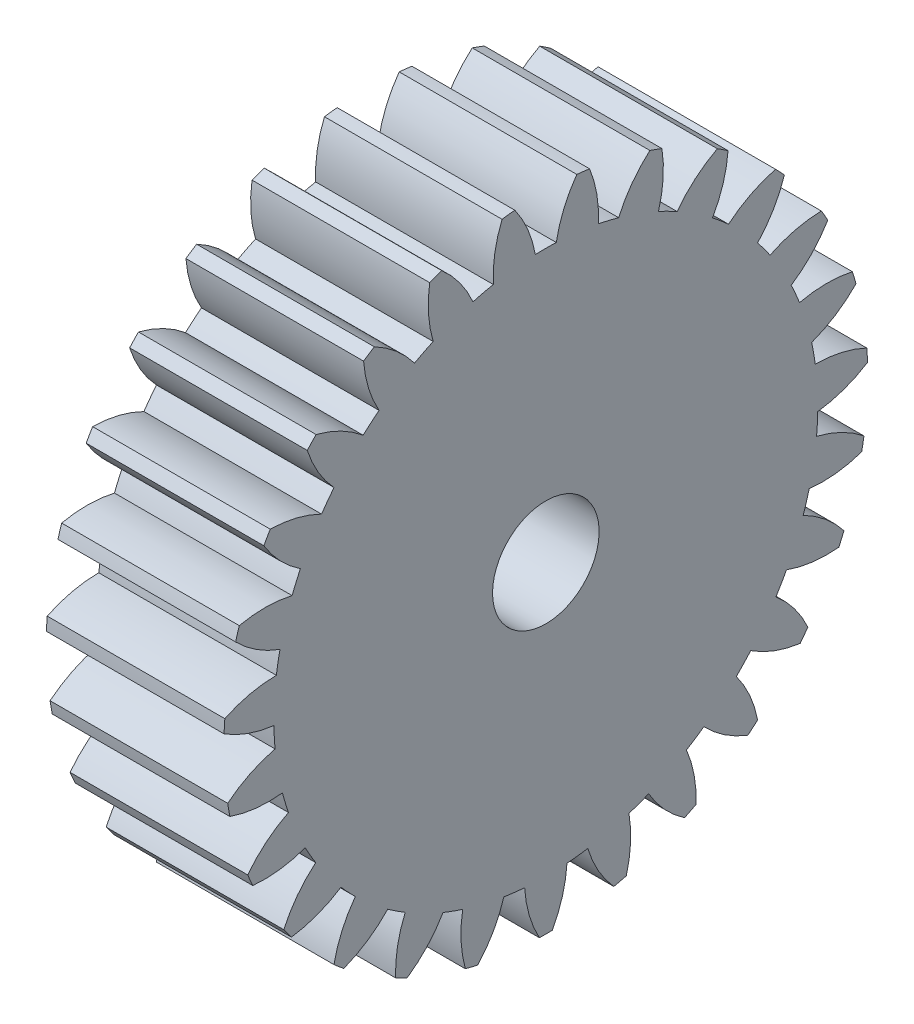
from build123d import *

# Parameters (mm, degrees)
SPUR_START               = -2.344914802
SPUR_GEAR_AM_OUTLINE_R   = 3
SPUR_GEAR_AM_DEPTH       = 10
RESSALTO_EXTRUS_O1_START = 4.5
ESBO_O9_R                = 8
ESBO_O9_R_2              = 3
RESSALTO_EXTRUS_O1_DEPTH = 4.5
FILETE1_R                = 1.5
CORTE_EXTRUS_O3_DEPTH    = 3
CHANFRO4_SIZE            = 0.7


# Read off the part's stored shape, not the designer's step: spur gear_am
with BuildPart() as part:
    # spur gear_am outline → spur gear_am (new body)
    with BuildSketch(Plane.YZ.offset(SPUR_START)):
        with BuildLine():
            ThreePointArc((23.883783824, 84.255149741), (23.52309445, 84.279769213), (23.161985782, 84.297189689))
            ThreePointArc((23.161985782, 84.297189689), (22.508279443, 82.951048342), (22.167237879, 81.493955635))
            ThreePointArc((22.167237879, 81.493955635), (21.578934878, 81.47102921), (20.991948176, 81.425502804))
            ThreePointArc((20.991948176, 81.425502804), (20.484054474, 82.833150662), (19.678490792, 84.09429921))
            ThreePointArc((19.678490792, 84.09429921), (19.321846205, 84.035074368), (18.96645383, 83.968747883))
            ThreePointArc((18.96645383, 83.968747883), (18.64080979, 82.508136893), (18.644989749, 81.011670711))
            ThreePointArc((18.644989749, 81.011670711), (18.077831728, 80.853690262), (17.51716644, 80.674022578))
            ThreePointArc((17.51716644, 80.674022578), (16.698337143, 81.926598758), (15.623646663, 82.967977113))
            ThreePointArc((15.623646663, 82.967977113), (15.290273666, 82.828100782), (14.959756879, 82.681603014))
            ThreePointArc((14.959756879, 82.681603014), (14.97973069, 81.185264298), (15.32890683, 79.730099521))
            ThreePointArc((15.32890683, 79.730099521), (14.813469426, 79.445581815), (14.309351163, 79.141458782))
            ThreePointArc((14.309351163, 79.141458782), (13.223729568, 80.171436577), (11.937849134, 80.936903764))
            ThreePointArc((11.937849134, 80.936903764), (11.645719951, 80.723916713), (11.357896997, 80.505145394))
            ThreePointArc((11.357896997, 80.505145394), (11.722411868, 79.053746961), (12.397760011, 77.718331898))
            ThreePointArc((12.397760011, 77.718331898), (11.961830588, 77.322615357), (11.541436495, 76.910432328))
            ThreePointArc((11.541436495, 76.910432328), (10.247548746, 77.66228537), (8.819800503, 78.110574853))
            ThreePointArc((8.819800503, 78.110574853), (8.584663894, 77.83595927), (8.355051383, 77.556708419))
            ThreePointArc((8.355051383, 77.556708419), (9.044456222, 76.228495532), (10.009568176, 75.084822755))
            ThreePointArc((10.009568176, 75.084822755), (9.676647801, 74.599240562), (9.362641435, 74.10121843))
            ThreePointArc((9.362641435, 74.10121843), (7.930241353, 74.534414126), (6.437595579, 74.641358504))
            ThreePointArc((6.437595579, 74.641358504), (6.27212782, 74.319918986), (6.113104222, 73.995243088))
            ThreePointArc((6.113104222, 73.995243088), (7.090233035, 72.861820049), (8.293079365, 71.971545254))
            ThreePointArc((8.293079365, 71.971545254), (8.081115863, 71.422275269), (7.890425386, 70.865262536))
            ThreePointArc((7.890425386, 70.865262536), (6.396734031, 70.956447194), (4.919659647, 70.716281067))
            ThreePointArc((4.919659647, 70.716281067), (4.832781147, 70.365346502), (4.752919465, 70.01274892))
            ThreePointArc((4.752919465, 70.01274892), (5.965094986, 69.135218857), (7.340829935, 68.546336988))
            ThreePointArc((7.340829935, 68.546336988), (7.261250311, 67.962990499), (7.204155897, 67.377015866))
            ThreePointArc((7.204155897, 67.377015866), (5.729698557, 67.121273697), (4.347825024, 66.546944484))
            ThreePointArc((4.347825024, 66.546944484), (4.344219426, 66.185433844), (4.347825024, 65.823923205))
            ThreePointArc((4.347825024, 65.823923205), (5.729698557, 65.249593992), (7.204155897, 64.993851823))
            ThreePointArc((7.204155897, 64.993851823), (7.261250311, 64.40787719), (7.340829935, 63.824530701))
            ThreePointArc((7.340829935, 63.824530701), (5.965094986, 63.235648832), (4.752919465, 62.358118769))
            ThreePointArc((4.752919465, 62.358118769), (4.832781147, 62.005521187), (4.919659647, 61.654586622))
            ThreePointArc((4.919659647, 61.654586622), (6.396734031, 61.414420495), (7.890425386, 61.505605153))
            ThreePointArc((7.890425386, 61.505605153), (8.081115863, 60.94859242), (8.293079365, 60.399322436))
            ThreePointArc((8.293079365, 60.399322436), (7.090233035, 59.50904764), (6.113104222, 58.375624601))
            ThreePointArc((6.113104222, 58.375624601), (6.27212782, 58.050948703), (6.437595579, 57.729509185))
            ThreePointArc((6.437595579, 57.729509185), (7.930241353, 57.836453563), (9.362641435, 58.269649259))
            ThreePointArc((9.362641435, 58.269649259), (9.676647801, 57.771627127), (10.009568176, 57.286044934))
            ThreePointArc((10.009568176, 57.286044934), (9.044456222, 56.142372157), (8.355051383, 54.81415927))
            ThreePointArc((8.355051383, 54.81415927), (8.584663894, 54.534908419), (8.819800503, 54.260292836))
            ThreePointArc((8.819800503, 54.260292836), (10.247548746, 54.708582319), (11.541436495, 55.460435361))
            ThreePointArc((11.541436495, 55.460435361), (11.961830588, 55.048252332), (12.397760011, 54.652535791))
            ThreePointArc((12.397760011, 54.652535791), (11.722411868, 53.317120728), (11.357896997, 51.865722295))
            ThreePointArc((11.357896997, 51.865722295), (11.645719951, 51.646950976), (11.937849134, 51.433963925))
            ThreePointArc((11.937849134, 51.433963925), (13.223729568, 52.199431112), (14.309351163, 53.229408907))
            ThreePointArc((14.309351163, 53.229408907), (14.813469426, 52.925285874), (15.32890683, 52.640768168))
            ThreePointArc((15.32890683, 52.640768168), (14.97973069, 51.185603391), (14.959756879, 49.689264676))
            ThreePointArc((14.959756879, 49.689264676), (15.290273666, 49.542766907), (15.623646663, 49.402890576))
            ThreePointArc((15.623646663, 49.402890576), (16.698337143, 50.444268931), (17.51716644, 51.696845111))
            ThreePointArc((17.51716644, 51.696845111), (18.077831728, 51.517177427), (18.644989749, 51.359196978))
            ThreePointArc((18.644989749, 51.359196978), (18.64080979, 49.862730796), (18.96645383, 48.402119806))
            ThreePointArc((18.96645383, 48.402119806), (19.321846205, 48.335793321), (19.678490792, 48.276568479))
            ThreePointArc((19.678490792, 48.276568479), (20.484054474, 49.537717027), (20.991948176, 50.945364885))
            ThreePointArc((20.991948176, 50.945364885), (21.578934878, 50.899838479), (22.167237879, 50.876912054))
            ThreePointArc((22.167237879, 50.876912054), (22.508279443, 49.419819347), (23.161985782, 48.073678))
            ThreePointArc((23.161985782, 48.073678), (23.52309445, 48.091098476), (23.883783824, 48.115717948))
            ThreePointArc((23.883783824, 48.115717948), (24.376792562, 49.528647844), (24.546369987, 51.01548072))
            ThreePointArc((24.546369987, 51.01548072), (25.128033498, 51.106549934), (25.705765913, 51.219913503))
            ThreePointArc((25.705765913, 51.219913503), (26.373643361, 49.880746516), (27.32017052, 48.721645639))
            ThreePointArc((27.32017052, 48.721645639), (27.667528019, 48.821873934), (28.012817323, 48.929010479))
            ThreePointArc((28.012817323, 48.929010479), (28.166692889, 50.417550306), (27.988812073, 51.903412655))
            ThreePointArc((27.988812073, 51.903412655), (28.533794764, 52.126167924), (29.069810889, 52.369710027))
            ThreePointArc((29.069810889, 52.369710027), (30.028518774, 51.220663599), (31.216839229, 50.311090621))
            ThreePointArc((31.216839229, 50.311090621), (31.531719426, 50.488723401), (31.842994024, 50.672601261))
            ThreePointArc((31.842994024, 50.672601261), (31.649440946, 52.156503451), (31.133691492, 53.561292049))
            ThreePointArc((31.133691492, 53.561292049), (31.612613202, 53.903724579), (32.078016269, 54.264315798))
            ThreePointArc((32.078016269, 54.264315798), (33.275870402, 53.367335319), (34.64192149, 52.756325555))
            ThreePointArc((34.64192149, 52.756325555), (34.907349112, 53.001786591), (35.167828111, 53.252492862))
            ThreePointArc((35.167828111, 53.252492862), (34.637280886, 54.651759865), (33.811466978, 55.899742195))
            ThreePointArc((33.811466978, 55.899742195), (34.198508917, 56.343391358), (34.568208925, 56.801592129))
            ThreePointArc((34.568208925, 56.801592129), (35.94063268, 56.205034048), (37.410770232, 55.925527192))
            ThreePointArc((37.410770232, 55.925527192), (37.612436008, 56.225583617), (37.808076916, 56.529602659))
            ThreePointArc((37.808076916, 56.529602659), (36.969137482, 57.768799629), (35.877778964, 58.79269664))
            ThreePointArc((35.877778964, 58.79269664), (36.152075598, 59.313645197), (36.406141926, 59.844753796))
            ThreePointArc((36.406141926, 59.844753796), (37.879147581, 59.580778714), (39.374116102, 59.647843053))
            ThreePointArc((39.374116102, 59.647843053), (39.501148178, 59.986318746), (39.621403944, 60.327260815))
            ThreePointArc((39.621403944, 60.327260815), (38.519299742, 61.339582321), (37.221232033, 62.084195462))
            ThreePointArc((37.221232033, 62.084195462), (37.367995962, 62.65435894), (37.492731827, 63.229743165))
            ThreePointArc((37.492731827, 63.229743165), (38.986909268, 63.312582047), (40.426114618, 63.722602126))
            ThreePointArc((40.426114618, 63.722602126), (40.47166466, 64.081249776), (40.510052265, 64.440734595))
            ThreePointArc((40.510052265, 64.440734595), (39.204198018, 65.171606124), (37.769400285, 65.596793106))
            ThreePointArc((37.769400285, 65.596793106), (37.780719426, 66.185433845), (37.769400285, 66.774074583))
            ThreePointArc((37.769400285, 66.774074583), (39.204198018, 67.199261565), (40.510052265, 67.930133094))
            ThreePointArc((40.510052265, 67.930133094), (40.47166466, 68.289617913), (40.426114618, 68.648265563))
            ThreePointArc((40.426114618, 68.648265563), (38.986909268, 69.058285642), (37.492731827, 69.141124524))
            ThreePointArc((37.492731827, 69.141124524), (37.367995962, 69.716508749), (37.221232033, 70.286672227))
            ThreePointArc((37.221232033, 70.286672227), (38.519299742, 71.031285368), (39.621403944, 72.043606874))
            ThreePointArc((39.621403944, 72.043606874), (39.501148178, 72.384548943), (39.374116102, 72.723024636))
            ThreePointArc((39.374116102, 72.723024636), (37.879147581, 72.790088975), (36.406141926, 72.526113894))
            ThreePointArc((36.406141926, 72.526113894), (36.152075598, 73.057222492), (35.877778964, 73.578171049))
            ThreePointArc((35.877778964, 73.578171049), (36.969137482, 74.60206806), (37.808076916, 75.84126503))
            ThreePointArc((37.808076916, 75.84126503), (37.612436008, 76.145284072), (37.410770232, 76.445340497))
            ThreePointArc((37.410770232, 76.445340497), (35.94063268, 76.165833641), (34.568208925, 75.56927556))
            ThreePointArc((34.568208925, 75.56927556), (34.198508917, 76.027476331), (33.811466978, 76.471125494))
            ThreePointArc((33.811466978, 76.471125494), (34.637280886, 77.719107824), (35.167828111, 79.118374827))
            ThreePointArc((35.167828111, 79.118374827), (34.907349112, 79.369081098), (34.64192149, 79.614542134))
            ThreePointArc((34.64192149, 79.614542134), (33.275870402, 79.00353237), (32.078016269, 78.106551891))
            ThreePointArc((32.078016269, 78.106551891), (31.612613202, 78.46714311), (31.133691492, 78.80957564))
            ThreePointArc((31.133691492, 78.80957564), (31.649440946, 80.214364238), (31.842994024, 81.698266428))
            ThreePointArc((31.842994024, 81.698266428), (31.531719426, 81.882144288), (31.216839229, 82.059777068))
            ThreePointArc((31.216839229, 82.059777068), (30.028518774, 81.15020409), (29.069810889, 80.001157662))
            ThreePointArc((29.069810889, 80.001157662), (28.533794764, 80.244699765), (27.988812073, 80.467455034))
            ThreePointArc((27.988812073, 80.467455034), (28.166692889, 81.953317383), (28.012817323, 83.44185721))
            ThreePointArc((28.012817323, 83.44185721), (27.667528019, 83.548993755), (27.32017052, 83.64922205))
            ThreePointArc((27.32017052, 83.64922205), (26.373643361, 82.490121173), (25.705765913, 81.150954186))
            ThreePointArc((25.705765913, 81.150954186), (25.128033498, 81.264317755), (24.546369987, 81.355386969))
            ThreePointArc((24.546369987, 81.355386969), (24.376792562, 82.842219845), (23.883783824, 84.255149741))
        make_face()
        with Locations((22.469219426, 66.185433845)):
            Circle(SPUR_GEAR_AM_OUTLINE_R, mode=Mode.SUBTRACT)
    extrude(amount=SPUR_GEAR_AM_DEPTH)

    # Esboço9 → Ressalto-extrusão1 (add)
    with BuildSketch(Plane.ZY.offset(2.344914802).offset(RESSALTO_EXTRUS_O1_START)):
        with Locations(Location((66.185433845, 22.469219426, 0), (0, 0, 180))):
            Circle(ESBO_O9_R)
        with Locations((66.185433845, 22.469219426)):
            Circle(ESBO_O9_R_2, mode=Mode.SUBTRACT)
    extrude(amount=-RESSALTO_EXTRUS_O1_DEPTH)

    # Filete1
    filete1_edges = [part.edges().sort_by_distance(p)[0] for p in [
        (-2.344914802, 22.469219426, 74.185433845),
    ]]
    fillet(filete1_edges, radius=FILETE1_R)

    # Esboço10 → Corte-extrusão3 (cut)
    with BuildSketch(Plane.ZY.offset(6.844914802)):
        with BuildLine():
            Line((69.185433845, 15.053020939), (69.185433845, 17.553020939))
            Line((69.185433845, 17.553020939), (63.185433845, 17.553020939))
            Line((63.185433845, 17.553020939), (63.185433845, 15.053020939))
            ThreePointArc((63.185433845, 15.053020939), (66.185433845, 14.469219426), (69.185433845, 15.053020939))
        make_face()
        with BuildLine():
            Line((73.601632332, 25.469219426), (71.101632332, 25.469219426))
            Line((71.101632332, 25.469219426), (71.101632332, 19.469219426))
            Line((71.101632332, 19.469219426), (73.601632332, 19.469219426))
            ThreePointArc((73.601632332, 19.469219426), (74.185433845, 22.469219426), (73.601632332, 25.469219426))
        make_face()
        with BuildLine():
            Line((63.185433845, 27.385417913), (63.185433845, 29.885417913))
            ThreePointArc((63.185433845, 29.885417913), (66.185433845, 30.469219426), (69.185433845, 29.885417913))
            Line((69.185433845, 29.885417913), (69.185433845, 27.385417913))
            Line((69.185433845, 27.385417913), (63.185433845, 27.385417913))
        make_face()
        with BuildLine():
            Line((61.269235357, 25.469219426), (58.769235357, 25.469219426))
            ThreePointArc((58.769235357, 25.469219426), (58.185433845, 22.469219426), (58.769235357, 19.469219426))
            Line((58.769235357, 19.469219426), (61.269235357, 19.469219426))
            Line((61.269235357, 19.469219426), (61.269235357, 25.469219426))
        make_face()
    extrude(amount=-CORTE_EXTRUS_O3_DEPTH, mode=Mode.SUBTRACT)

    # Chanfro4
    chanfro4_edges = [part.edges().sort_by_distance(p)[0] for p in [
        (-6.844914802, 27.385417913, 66.185433845),
        (-6.844914802, 28.635417913, 69.185433845),
        (-6.844914802, 28.635417913, 63.185433845),
        (-6.844914802, 22.469219426, 71.101632332),
        (-6.844914802, 19.469219426, 72.351632332),
        (-6.844914802, 25.469219426, 72.351632332),
        (-6.844914802, 22.469219426, 61.269235357),
        (-6.844914802, 25.469219426, 60.019235357),
        (-6.844914802, 19.469219426, 60.019235357),
        (-6.844914802, 17.553020939, 66.185433845),
        (-6.844914802, 16.303020939, 63.185433845),
        (-6.844914802, 16.303020939, 69.185433845),
    ]]
    chamfer(chanfro4_edges, length=CHANFRO4_SIZE)


solid = part.part
